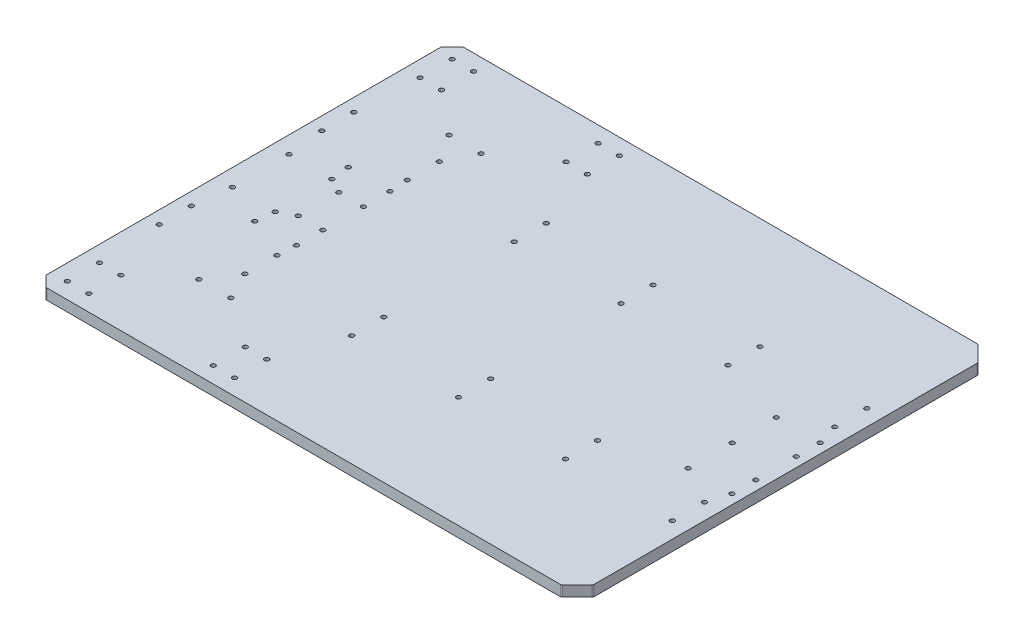
from build123d import *

# Parameters (mm, degrees)
SKETCH1_W                 = 507
SKETCH1_H                 = 390
BOSS_EXTRUDE1_DEPTH       = 10
CHAMFER1_SIZE             = 15
CHAMFER2_SIZE             = 10
FILLET1_R                 = 2
M5_TAPPED_HOLE1_OUTLINE_R = 2.1
M5_TAPPED_HOLE1_DEPTH     = 10


# Read off the part's stored shape, not the designer's step: M5 Tapped Hole1
with BuildPart() as part:
    # Sketch1 → Boss-Extrude1 (new body)
    with BuildSketch(Plane(origin=(0, 0, 0), x_dir=(1, 0, 0), z_dir=(0, 1, 0))):
        Rectangle(SKETCH1_W, SKETCH1_H)
    extrude(amount=BOSS_EXTRUDE1_DEPTH)

    # Chamfer1
    chamfer1_edges = [part.edges().sort_by_distance(p)[0] for p in [
        (253.5, 5, 195),
        (253.5, 5, -195),
    ]]
    chamfer(chamfer1_edges, length=CHAMFER1_SIZE)

    # Chamfer2
    chamfer2_edges = [part.edges().sort_by_distance(p)[0] for p in [
        (-253.5, 5, 195),
        (-253.5, 5, -195),
    ]]
    chamfer(chamfer2_edges, length=CHAMFER2_SIZE)

    # Fillet1
    fillet1_edges = [part.edges().sort_by_distance(p)[0] for p in [
        (238.5, 5, -195),
        (253.5, 5, 180),
        (253.5, 5, -180),
        (238.5, 5, 195),
        (-253.5, 5, 185),
        (-253.5, 5, -185),
        (-243.5, 5, -195),
        (-243.5, 5, 195),
    ]]
    fillet(fillet1_edges, radius=FILLET1_R)

    # M5 Tapped Hole1 outline → M5 Tapped Hole1 (cut)
    with BuildSketch(Plane(origin=(0, 0, 0), x_dir=(1, 0, 0), z_dir=(0, 1, 0))):
        with Locations((203.5, -41.25)):
            Circle(M5_TAPPED_HOLE1_OUTLINE_R)
        with Locations((203.5, 41.25)):
            Circle(M5_TAPPED_HOLE1_OUTLINE_R)
        with Locations((-197.6, 26.5)):
            Circle(M5_TAPPED_HOLE1_OUTLINE_R)
        with Locations((-237.6, 26.5)):
            Circle(M5_TAPPED_HOLE1_OUTLINE_R)
        with Locations((-197.6, -26.5)):
            Circle(M5_TAPPED_HOLE1_OUTLINE_R)
        with Locations((-237.6, -26.5)):
            Circle(M5_TAPPED_HOLE1_OUTLINE_R)
        with Locations((-199.5, -43.75)):
            Circle(M5_TAPPED_HOLE1_OUTLINE_R)
        with Locations((-199.5, 43.75)):
            Circle(M5_TAPPED_HOLE1_OUTLINE_R)
        with Locations((-160.5, -43.75)):
            Circle(M5_TAPPED_HOLE1_OUTLINE_R)
        with Locations((-160.5, 43.75)):
            Circle(M5_TAPPED_HOLE1_OUTLINE_R)
        with Locations((-160.5, 19)):
            Circle(M5_TAPPED_HOLE1_OUTLINE_R)
        with Locations((-183.5, 19)):
            Circle(M5_TAPPED_HOLE1_OUTLINE_R)
        with Locations((-160.5, -19)):
            Circle(M5_TAPPED_HOLE1_OUTLINE_R)
        with Locations((-183.5, -19)):
            Circle(M5_TAPPED_HOLE1_OUTLINE_R)
        with Locations((244.5, 41.25)):
            Circle(M5_TAPPED_HOLE1_OUTLINE_R)
        with Locations((244.5, 19)):
            Circle(M5_TAPPED_HOLE1_OUTLINE_R)
        with Locations((244.5, -19)):
            Circle(M5_TAPPED_HOLE1_OUTLINE_R)
        with Locations((244.5, -41.25)):
            Circle(M5_TAPPED_HOLE1_OUTLINE_R)
        with Locations((203.5, 0)):
            Circle(M5_TAPPED_HOLE1_OUTLINE_R)
        with Locations((238.5, -91)):
            Circle(M5_TAPPED_HOLE1_OUTLINE_R)
        with Locations((238.5, -61)):
            Circle(M5_TAPPED_HOLE1_OUTLINE_R)
        with Locations((138.5, -91)):
            Circle(M5_TAPPED_HOLE1_OUTLINE_R)
        with Locations((138.5, -61)):
            Circle(M5_TAPPED_HOLE1_OUTLINE_R)
        with Locations((38.5, -91)):
            Circle(M5_TAPPED_HOLE1_OUTLINE_R)
        with Locations((38.5, -61)):
            Circle(M5_TAPPED_HOLE1_OUTLINE_R)
        with Locations((-61.5, -91)):
            Circle(M5_TAPPED_HOLE1_OUTLINE_R)
        with Locations((-61.5, -61)):
            Circle(M5_TAPPED_HOLE1_OUTLINE_R)
        with Locations((-161.5, -61)):
            Circle(M5_TAPPED_HOLE1_OUTLINE_R)
        with Locations((-161.5, -91)):
            Circle(M5_TAPPED_HOLE1_OUTLINE_R)
        with Locations((-241.5, -91)):
            Circle(M5_TAPPED_HOLE1_OUTLINE_R)
        with Locations((-241.5, -61)):
            Circle(M5_TAPPED_HOLE1_OUTLINE_R)
        with Locations((238.5, 61)):
            Circle(M5_TAPPED_HOLE1_OUTLINE_R)
        with Locations((238.5, 91)):
            Circle(M5_TAPPED_HOLE1_OUTLINE_R)
        with Locations((138.5, 61)):
            Circle(M5_TAPPED_HOLE1_OUTLINE_R)
        with Locations((138.5, 91)):
            Circle(M5_TAPPED_HOLE1_OUTLINE_R)
        with Locations((38.5, 61)):
            Circle(M5_TAPPED_HOLE1_OUTLINE_R)
        with Locations((38.5, 91)):
            Circle(M5_TAPPED_HOLE1_OUTLINE_R)
        with Locations((-61.5, 61)):
            Circle(M5_TAPPED_HOLE1_OUTLINE_R)
        with Locations((-61.5, 91)):
            Circle(M5_TAPPED_HOLE1_OUTLINE_R)
        with Locations((-161.5, 91)):
            Circle(M5_TAPPED_HOLE1_OUTLINE_R)
        with Locations((-161.5, 61)):
            Circle(M5_TAPPED_HOLE1_OUTLINE_R)
        with Locations((-241.5, 91)):
            Circle(M5_TAPPED_HOLE1_OUTLINE_R)
        with Locations((-241.5, 61)):
            Circle(M5_TAPPED_HOLE1_OUTLINE_R)
        with Locations((-82, -180)):
            Circle(M5_TAPPED_HOLE1_OUTLINE_R)
        with Locations((-102, -180)):
            Circle(M5_TAPPED_HOLE1_OUTLINE_R)
        with Locations((-82, -150)):
            Circle(M5_TAPPED_HOLE1_OUTLINE_R)
        with Locations((-102, -150)):
            Circle(M5_TAPPED_HOLE1_OUTLINE_R)
        with Locations((-218.5, -180)):
            Circle(M5_TAPPED_HOLE1_OUTLINE_R)
        with Locations((-238.5, -180)):
            Circle(M5_TAPPED_HOLE1_OUTLINE_R)
        with Locations((-218.5, -150)):
            Circle(M5_TAPPED_HOLE1_OUTLINE_R)
        with Locations((-238.5, -150)):
            Circle(M5_TAPPED_HOLE1_OUTLINE_R)
        with Locations((-148.5, -117)):
            Circle(M5_TAPPED_HOLE1_OUTLINE_R)
        with Locations((-178.5, -117)):
            Circle(M5_TAPPED_HOLE1_OUTLINE_R)
        with Locations((-148.5, 117)):
            Circle(M5_TAPPED_HOLE1_OUTLINE_R)
        with Locations((-178.5, 117)):
            Circle(M5_TAPPED_HOLE1_OUTLINE_R)
        with Locations((-82, 150)):
            Circle(M5_TAPPED_HOLE1_OUTLINE_R)
        with Locations((-102, 150)):
            Circle(M5_TAPPED_HOLE1_OUTLINE_R)
        with Locations((-82, 180)):
            Circle(M5_TAPPED_HOLE1_OUTLINE_R)
        with Locations((-102, 180)):
            Circle(M5_TAPPED_HOLE1_OUTLINE_R)
        with Locations((-218.5, 150)):
            Circle(M5_TAPPED_HOLE1_OUTLINE_R)
        with Locations((-238.5, 150)):
            Circle(M5_TAPPED_HOLE1_OUTLINE_R)
        with Locations((-218.5, 180)):
            Circle(M5_TAPPED_HOLE1_OUTLINE_R)
        with Locations((-238.5, 180)):
            Circle(M5_TAPPED_HOLE1_OUTLINE_R)
    extrude(amount=M5_TAPPED_HOLE1_DEPTH, mode=Mode.SUBTRACT)


solid = part.part
